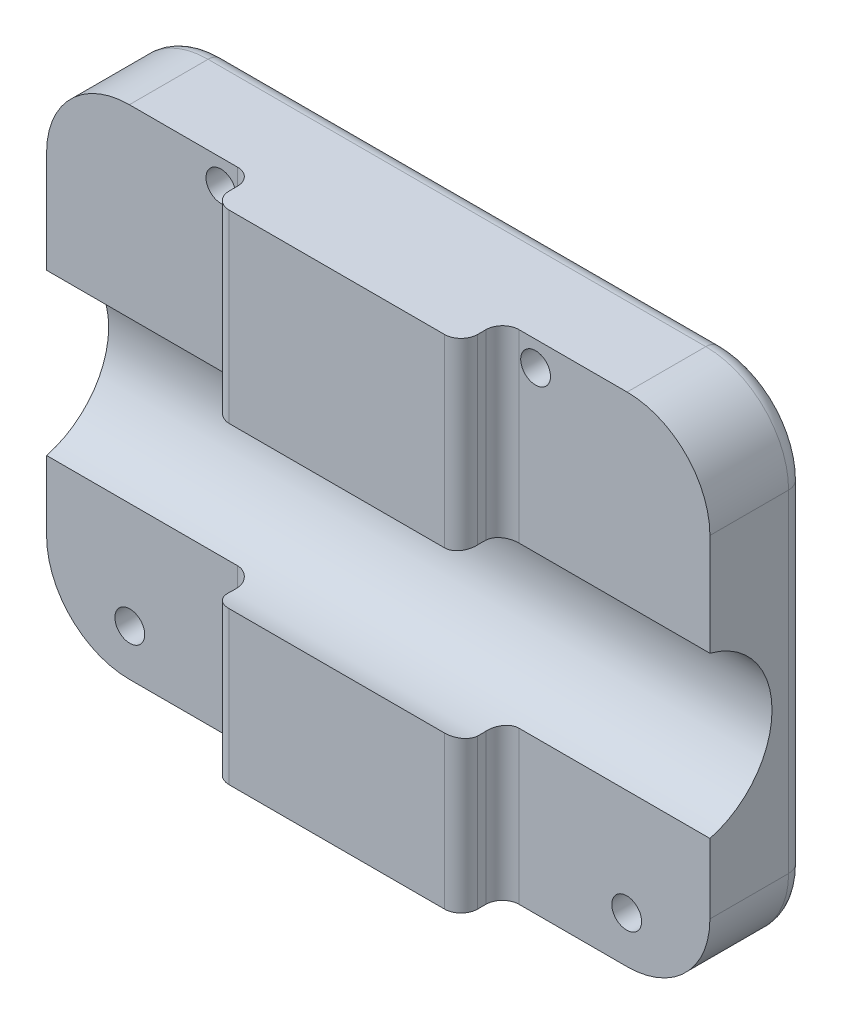
from build123d import *

# Parameters (mm, degrees)
SKETCH_1_W          = 80.1
SKETCH_1_H          = 60.1
EXTRUDE_1_DEPTH     = 28
CUT_EXTRUDE_1_DEPTH = 108
CUT_EXTRUDE_2_DEPTH = 80
FILLET_1_R          = 2
SKETCH_4_R          = 1.8
CUT_EXTRUDE_3_DEPTH = 80
FILLET_2_R          = 10
FILLET_3_R          = 2


with BuildPart() as part:
    # 草图1 → 凸台-拉伸1 (new body)
    with BuildSketch(Plane.XY):
        with Locations((40.05, -30.05)):
            Rectangle(SKETCH_1_W, SKETCH_1_H)
    extrude(amount=EXTRUDE_1_DEPTH)

    # 草图2 → 切除-拉伸1 (cut)
    with BuildSketch(Plane(origin=(80.1, 0, 0), x_dir=(0, 0, -1), z_dir=(1, 0, 0))):
        with BuildLine():
            ThreePointArc((-4, -32), (-6.928932188, -24.928932188), (-14, -22))
            Line((-14, -22), (-14, -32))
            Line((-14, -32), (-4, -32))
        make_face()
        with BuildLine():
            Line((-14, -32), (-14, -22))
            ThreePointArc((-14, -22), (-21.071067812, -24.928932188), (-24, -32))
            Line((-24, -32), (-14, -32))
        make_face()
        with BuildLine():
            Line((-4, -32), (-14, -32))
            Line((-14, -32), (-14, -42))
            ThreePointArc((-14, -42), (-6.928932188, -39.071067812), (-4, -32))
        make_face()
        with BuildLine():
            Line((-14, -42), (-14, -32))
            Line((-14, -32), (-24, -32))
            ThreePointArc((-24, -32), (-21.071067812, -39.071067812), (-14, -42))
        make_face()
    extrude(amount=-CUT_EXTRUDE_1_DEPTH, mode=Mode.SUBTRACT)

    # 草图3 → 切除-拉伸2 (cut)
    with BuildSketch(Plane(origin=(0, 0, 0), x_dir=(1, 0, 0), z_dir=(0, 1, 0))):
        Polygon((25.05, -11.5), (0, -11.5), (0, -28), (80.1, -28), (80.1, -11.5), (55.05, -11.5), (55.05, -16.5), (25.05, -16.5), align=None)
    extrude(amount=-CUT_EXTRUDE_2_DEPTH, mode=Mode.SUBTRACT)

    # 圆角1
    fillet_1_edges = [part.edges().sort_by_distance(p)[0] for p in [
        (55.05, -50.891229183, 11.5),
        (55.05, -11.158770817, 11.5),
        (25.05, -50.891229183, 11.5),
        (25.05, -11.158770817, 11.5),
        (25.05, -50.891229183, 16.5),
        (25.05, -11.158770817, 16.5),
        (55.05, -50.891229183, 16.5),
        (55.05, -11.158770817, 16.5),
    ]]
    fillet(fillet_1_edges, radius=FILLET_1_R)

    # 草图4 → 切除-拉伸3 (cut)
    with BuildSketch(Plane(origin=(0, 0, 0), x_dir=(-1, 0, 0), z_dir=(0, 0, -1))):
        with Locations((-70.05, -54.5)):
            Circle(SKETCH_4_R)
        with Locations((-10.05, -54.5)):
            Circle(SKETCH_4_R)
        with Locations((-21.05, -3)):
            Circle(SKETCH_4_R)
        with Locations((-59.05, -3)):
            Circle(SKETCH_4_R)
    extrude(amount=-CUT_EXTRUDE_3_DEPTH, mode=Mode.SUBTRACT)

    # 圆角2
    fillet_2_edges = [part.edges().sort_by_distance(p)[0] for p in [
        (0, 0, 5.75),
        (80.1, 0, 5.75),
        (80.1, -60.1, 5.75),
        (0, -60.1, 5.75),
    ]]
    fillet(fillet_2_edges, radius=FILLET_2_R)

    # 圆角3
    # the kernel refuses this fillet: 2 mm, written as the material it takes off along each edge
    with BuildSketch(Plane(origin=(80.1, -10, 0), x_dir=(-1, 0, 0), z_dir=(0, -1, 0)), Plane(origin=(0, -50.1, 0), x_dir=(1, 0, 0), z_dir=(0, 1, 0))) as fillet_3_piece_1:
        with BuildLine():
            CenterArc((FILLET_3_R, -FILLET_3_R), FILLET_3_R, 90, 90)
            Line((0, -FILLET_3_R), (0, 0))
            Line((0, 0), (FILLET_3_R, 0))
        make_face()
    extrude(amount=40.1, mode=Mode.SUBTRACT)
    with BuildSketch(Plane(origin=(10, 0, 0), x_dir=(0, 0, 1), z_dir=(1, 0, 0))) as fillet_3_piece_2:
        with BuildLine():
            CenterArc((FILLET_3_R, FILLET_3_R), FILLET_3_R, 180, 90)
            Line((0, FILLET_3_R), (0, 0))
            Line((0, 0), (FILLET_3_R, 0))
        make_face()
    extrude(amount=60.1, mode=Mode.SUBTRACT)
    with BuildSketch(Plane(origin=(70.1, -60.1, 0), x_dir=(0, 1, 0), z_dir=(-1, 0, 0))) as fillet_3_piece_3:
        with BuildLine():
            CenterArc((FILLET_3_R, -FILLET_3_R), FILLET_3_R, 90, 90)
            Line((0, -FILLET_3_R), (0, 0))
            Line((0, 0), (FILLET_3_R, 0))
        make_face()
    extrude(amount=60.1, mode=Mode.SUBTRACT)
    with BuildSketch(Plane(origin=(10, -10, 0), x_dir=(0, 1, 0), z_dir=(1, 0, 0))) as fillet_3_piece_4:
        with BuildLine():
            CenterArc((10 - FILLET_3_R, FILLET_3_R), FILLET_3_R, 270, 90)
            Line((10, FILLET_3_R), (10, 0))
            Line((10, 0), (10 - FILLET_3_R, 0))
        make_face()
    revolve(axis=Axis((10, -10, 0), (0, 0, 1)), revolution_arc=90, mode=Mode.SUBTRACT)
    with BuildSketch(Plane(origin=(10, -50.1, 0), x_dir=(-1, 0, 0), z_dir=(0, 1, 0))) as fillet_3_piece_5:
        with BuildLine():
            CenterArc((10 - FILLET_3_R, FILLET_3_R), FILLET_3_R, 270, 90)
            Line((10, FILLET_3_R), (10, 0))
            Line((10, 0), (10 - FILLET_3_R, 0))
        make_face()
    revolve(axis=Axis((10, -50.1, 0), (0, 0, 1)), revolution_arc=90, mode=Mode.SUBTRACT)
    with BuildSketch(Plane(origin=(70.1, -10, 0), x_dir=(0, 1, 0), z_dir=(-1, 0, 0))) as fillet_3_piece_6:
        with BuildLine():
            CenterArc((10 - FILLET_3_R, -FILLET_3_R), FILLET_3_R, 0, 90)
            Line((10 - FILLET_3_R, 0), (10, 0))
            Line((10, 0), (10, -FILLET_3_R))
        make_face()
    revolve(axis=Axis((70.1, -10, 0), (0, 0, -1)), revolution_arc=90, mode=Mode.SUBTRACT)
    with BuildSketch(Plane(origin=(70.1, -50.1, 0), x_dir=(1, 0, 0), z_dir=(0, 1, 0))) as fillet_3_piece_7:
        with BuildLine():
            CenterArc((10 - FILLET_3_R, -FILLET_3_R), FILLET_3_R, 0, 90)
            Line((10, -FILLET_3_R), (10, 0))
            Line((10, 0), (10 - FILLET_3_R, 0))
        make_face()
    revolve(axis=Axis((70.1, -50.1, 0), (0, 0, -1)), revolution_arc=90, mode=Mode.SUBTRACT)


solid = part.part
